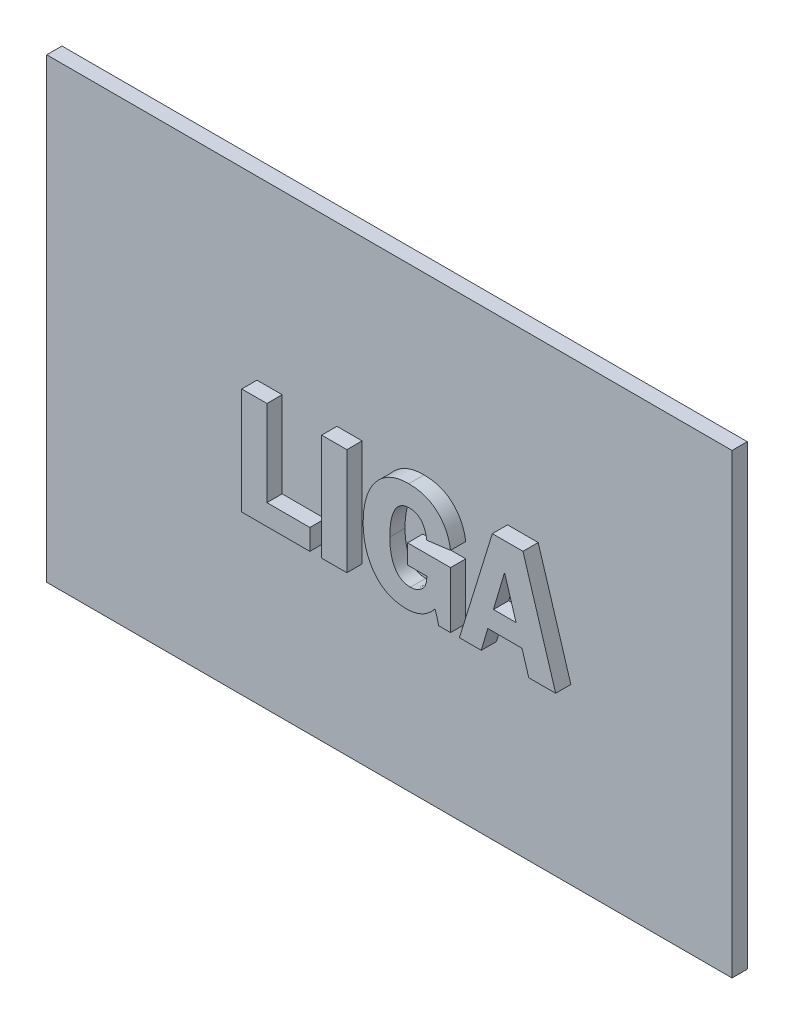
from build123d import *

# Parameters (mm, degrees)
SKETCH1_W           = 22.5
SKETCH1_H           = 15
BOSS_EXTRUDE1_DEPTH = 0.5
WRAP1_OUTLINE_W     = 0.826388889
WRAP1_OUTLINE_H     = 3.5
WRAP1_DEPTH         = 0.5


# Read off the part's stored shape, not the designer's step: Wrap1
with BuildPart() as part:
    # Sketch1 → Boss-Extrude1 (new body)
    with BuildSketch(Plane.XY):
        Rectangle(SKETCH1_W, SKETCH1_H)
    extrude(amount=BOSS_EXTRUDE1_DEPTH)

    # Wrap1 outline → Wrap1 (add)
    # profile 1 of 4: a face of its own
    with BuildSketch(Plane.XY.offset(0.5)):
        with BuildLine():
            add(Edge.make_bspline(
                [(2.118055556, -1.8), (2.102101425, -1.731019264), (2.069534878, -1.59021157), (2.021189223, -1.454006194), (1.996527778, -1.38452691)],
                knots=[0, 0, 0, 0, 0.489893232, 1, 1, 1, 1], degree=3))
            Line((2.118055556, -1.8), (2.506944444, -1.8))
            Line((2.506944444, -1.8), (2.506944444, 0.047222222))
            Line((2.506944444, 0.047222222), (1.097222222, 0.047222222))
            Line((1.097222222, 0.047222222), (1.097222222, -0.584722222))
            Line((1.097222222, -0.584722222), (1.729166667, -0.584722222))
            add(Edge.make_bspline(
                [(1.189887153, -1.168055556), (1.224007135, -1.166641415), (1.291557812, -1.163841703), (1.389411618, -1.135479706), (1.48186011, -1.091912059), (1.552522736, -1.041311507), (1.604163451, -0.992684417), (1.637831654, -0.949615289), (1.665872255, -0.901112075), (1.689666798, -0.848077449), (1.70692943, -0.789214567), (1.719447815, -0.72564884), (1.728419327, -0.65687553), (1.728911975, -0.609311898), (1.729166667, -0.584722222)],
                knots=[0, 0, 0, 0, 0.113839351, 0.225378937, 0.337862557, 0.454399889, 0.514282548, 0.574582762, 0.636443988, 0.701264893, 0.768496234, 0.841060889, 0.917830892, 1, 1, 1, 1], degree=3))
            add(Edge.make_bspline(
                [(0.513888889, -0.076584201), (0.514572313, -0.119635576), (0.515896024, -0.203021042), (0.523217979, -0.32423507), (0.536468218, -0.437450039), (0.556814389, -0.542753882), (0.58016669, -0.640850258), (0.610908424, -0.730891969), (0.646278395, -0.813189447), (0.687302005, -0.887392166), (0.733771509, -0.953045942), (0.784892562, -1.010472833), (0.840544687, -1.059907744), (0.901681039, -1.099399842), (0.967335449, -1.130329733), (1.037327541, -1.152255059), (1.112172234, -1.165456245), (1.163501396, -1.167173038), (1.189887153, -1.168055556)],
                knots=[0, 0, 0, 0, 0.089605155, 0.173554681, 0.252640076, 0.326637626, 0.396673525, 0.462328207, 0.524393538, 0.582893738, 0.638453156, 0.691446992, 0.742603933, 0.792882167, 0.842383995, 0.893214225, 0.945106771, 1, 1, 1, 1], degree=3))
            add(Edge.make_bspline(
                [(1.155707465, 1.068055556), (1.130075838, 1.067210899), (1.079949494, 1.065559051), (1.00696703, 1.051696413), (0.938909467, 1.028085171), (0.875814409, 0.994871993), (0.817591808, 0.952846932), (0.76484425, 0.901059239), (0.716596885, 0.840386196), (0.673656251, 0.770352319), (0.635825562, 0.691866233), (0.603288773, 0.605321415), (0.575274497, 0.511186428), (0.552534046, 0.408895639), (0.535554331, 0.298727159), (0.522524141, 0.180656658), (0.514960566, 0.054664626), (0.514252816, -0.03201382), (0.513888889, -0.076584201)],
                knots=[0, 0, 0, 0, 0.052392573, 0.102461232, 0.15126336, 0.199209074, 0.247788165, 0.29759102, 0.349914456, 0.405956949, 0.465245134, 0.527852777, 0.594860669, 0.665966982, 0.741990387, 0.822734633, 0.908849485, 1, 1, 1, 1], degree=3))
            add(Edge.make_bspline(
                [(1.729166667, 0.436111111), (1.725153755, 0.461736316), (1.717367072, 0.511459652), (1.701192738, 0.583185082), (1.6824977, 0.649991098), (1.660322693, 0.711876638), (1.635538667, 0.768921126), (1.607174662, 0.820915366), (1.576291477, 0.868236988), (1.541672833, 0.910237935), (1.50458923, 0.948097333), (1.463146746, 0.97958563), (1.419810775, 1.00755935), (1.372711281, 1.02959383), (1.322861274, 1.047089034), (1.269581929, 1.059092439), (1.213672152, 1.066996713), (1.175230511, 1.067698927), (1.155707465, 1.068055556)],
                knots=[0, 0, 0, 0, 0.082191489, 0.159484973, 0.232898467, 0.301940512, 0.367695662, 0.429819924, 0.48946921, 0.54649677, 0.602106423, 0.65700512, 0.711106214, 0.765308393, 0.821396578, 0.878237506, 0.938161464, 1, 1, 1, 1], degree=3))
            Line((1.729166667, 0.436111111), (2.506944444, 0.537890625))
            add(Edge.make_bspline(
                [(1.13671875, 1.748611111), (1.183852349, 1.747570689), (1.276092384, 1.745534592), (1.411034443, 1.730174961), (1.539027431, 1.704764538), (1.659857093, 1.667729236), (1.774225525, 1.621890079), (1.880970414, 1.564492815), (1.980736808, 1.497041103), (2.072943296, 1.419502923), (2.158223008, 1.333869175), (2.234134407, 1.240180481), (2.301231448, 1.13974161), (2.361087022, 1.033221224), (2.410889646, 0.919073074), (2.452005017, 0.798088035), (2.484825247, 0.670596043), (2.499495457, 0.582581264), (2.506944444, 0.537890625)],
                knots=[0, 0, 0, 0, 0.070069074, 0.137124556, 0.201650146, 0.263813257, 0.324771258, 0.384560312, 0.443656803, 0.503520473, 0.563413726, 0.623088901, 0.682497508, 0.742828077, 0.80451978, 0.867376611, 0.932658764, 1, 1, 1, 1], degree=3))
            add(Edge.make_bspline(
                [(-0.361111111, -0.097092014), (-0.360056629, -0.029193424), (-0.357998366, 0.103338977), (-0.338716764, 0.296809121), (-0.30692414, 0.479850097), (-0.262920099, 0.652858131), (-0.207057789, 0.816068001), (-0.137589586, 0.968937488), (-0.055342885, 1.111319656), (0.038529131, 1.243069192), (0.144049567, 1.361084804), (0.258050156, 1.46596394), (0.383121972, 1.552519732), (0.516042062, 1.624841653), (0.658464001, 1.680557916), (0.809966935, 1.71955882), (0.970283346, 1.744948697), (1.080412506, 1.747372091), (1.13671875, 1.748611111)],
                knots=[0, 0, 0, 0, 0.076094269, 0.148529686, 0.217678594, 0.284172559, 0.348435986, 0.410796815, 0.472084106, 0.532492434, 0.591791888, 0.649255708, 0.705707708, 0.761835604, 0.81854385, 0.876643326, 0.936930864, 1, 1, 1, 1], degree=3))
            add(Edge.make_bspline(
                [(1.059244792, -1.848611111), (1.004723071, -1.847238309), (0.89821979, -1.844556663), (0.743173288, -1.821117291), (0.597057137, -1.783836147), (0.461013751, -1.729005295), (0.333422729, -1.660627785), (0.216232156, -1.575256979), (0.107153099, -1.476073515), (0.009896653, -1.360905337), (-0.076894112, -1.234286084), (-0.153291075, -1.098351542), (-0.218137905, -0.953529332), (-0.27026294, -0.799278052), (-0.311528227, -0.636281671), (-0.339716794, -0.464234977), (-0.35768967, -0.28356275), (-0.359953571, -0.160178706), (-0.361111111, -0.097092014)],
                knots=[0, 0, 0, 0, 0.064345405, 0.125692964, 0.184718006, 0.242009577, 0.298461161, 0.355213548, 0.412768934, 0.472141974, 0.532760404, 0.593797592, 0.656024627, 0.719840029, 0.785822383, 0.854335256, 0.925521109, 1, 1, 1, 1], degree=3))
            add(Edge.make_bspline(
                [(1.996527778, -1.38452691), (1.965683846, -1.421481302), (1.905191378, -1.493957872), (1.802494662, -1.587913316), (1.69486425, -1.668972518), (1.580037705, -1.734766305), (1.458573377, -1.785831157), (1.330913621, -1.822576666), (1.196939841, -1.844019509), (1.105653567, -1.847063556), (1.059244792, -1.848611111)],
                knots=[0, 0, 0, 0, 0.133004575, 0.260854394, 0.383963685, 0.505044677, 0.625870246, 0.747551188, 0.871658247, 1, 1, 1, 1], degree=3))
        make_face()
    # profile 2 of 4: a face of its own
    with BuildSketch(Plane.XY.offset(0.5)):
        Polygon((-2.111111111, -1.8), (-2.111111111, -1.119444444), (-3.520833333, -1.119444444), (-3.520833333, 1.7), (-4.347222222, 1.7), (-4.347222222, -1.8), align=None)
    # profile 3 of 4: a face of its own
    with BuildSketch(Plane.XY.offset(0.5)):
        with Locations((-1.309027778, -0.05)):
            Rectangle(WRAP1_OUTLINE_W, WRAP1_OUTLINE_H)
    # profile 4 of 4: a face of its own
    with BuildSketch(Plane.XY.offset(0.5)):
        Polygon((5.076497396, -1.8), (5.958333333, -1.8), (4.885850694, 1.7), (3.880208333, 1.7), (2.798611111, -1.8), (3.516384549, -1.8), (3.731336806, -1.070833333), (4.853190104, -1.070833333), align=None)
        Polygon((4.28125, 0.795377604), (4.659505208, -0.438888889), (3.917426215, -0.438888889), align=None, mode=Mode.SUBTRACT)
    extrude(amount=WRAP1_DEPTH)


solid = part.part
